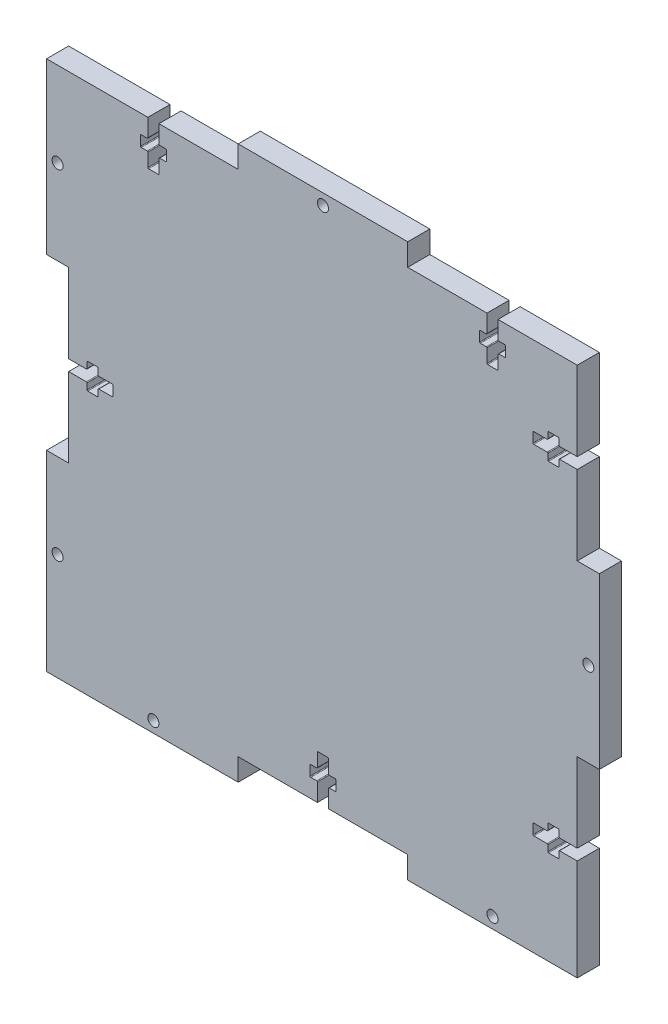
from build123d import *

# Parameters (mm, degrees)
BOX_SIDE_DEPTH       = 6
SKETCH2_R            = 1.5
SCREW_CUT_OUTS_DEPTH = 107.235587258


with BuildPart() as part:
    # Sketch1 → Box Side (new body)
    with BuildSketch(Plane.XY):
        Polygon((-69, 69), (-23, 69), (-23, 75), (23, 75), (23, 69), (69, 69), (69, 23), (75, 23), (75, -23), (69, -23), (69, -69), (69, -75), (23, -75), (23, -69), (-23, -69), (-23, -75), (-69, -75), (-75, -75), (-75, -69), (-75, -23), (-69, -23), (-69, 23), (-75, 23), (-75, 69), align=None)
    extrude(amount=BOX_SIDE_DEPTH)

    # Sketch2 → Screw Cut-outs (cut, through all)
    with BuildSketch(Plane.XY.offset(6)):
        with Locations((0, 72)):
            Circle(SKETCH2_R)
        with Locations((72, 0)):
            Circle(SKETCH2_R)
        with Locations((-46, -72)):
            Circle(SKETCH2_R)
        with Locations((46, -72)):
            Circle(SKETCH2_R)
        with Locations((-72, 46)):
            Circle(SKETCH2_R)
        with Locations((-72, -46)):
            Circle(SKETCH2_R)
        with BuildLine():
            Line((-44.5, 69), (-44.5, 64.2))
            ThreePointArc((-44.5, 64.2), (-44.441421356, 64.058578644), (-44.3, 64))
            Line((-44.3, 64), (-42.7, 64))
            ThreePointArc((-42.7, 64), (-42.558578644, 63.941421356), (-42.5, 63.8))
            Line((-42.5, 63.8), (-42.5, 61.2))
            ThreePointArc((-42.5, 61.2), (-42.558578644, 61.058578644), (-42.7, 61))
            Line((-42.7, 61), (-44.3, 61))
            ThreePointArc((-44.3, 61), (-44.441421356, 60.941421356), (-44.5, 60.8))
            Line((-44.5, 60.8), (-44.5, 57.2))
            ThreePointArc((-44.5, 57.2), (-44.558578644, 57.058578644), (-44.7, 57))
            Line((-44.7, 57), (-47.3, 57))
            ThreePointArc((-47.3, 57), (-47.441421356, 57.058578644), (-47.5, 57.2))
            Line((-47.5, 57.2), (-47.5, 60.8))
            ThreePointArc((-47.5, 60.8), (-47.558578644, 60.941421356), (-47.7, 61))
            Line((-47.7, 61), (-49.3, 61))
            ThreePointArc((-49.3, 61), (-49.441421356, 61.058578644), (-49.5, 61.2))
            Line((-49.5, 61.2), (-49.5, 63.8))
            ThreePointArc((-49.5, 63.8), (-49.441421356, 63.941421356), (-49.3, 64))
            Line((-49.3, 64), (-47.7, 64))
            ThreePointArc((-47.7, 64), (-47.558578644, 64.058578644), (-47.5, 64.2))
            Line((-47.5, 64.2), (-47.5, 69))
            Line((-47.5, 69), (-44.5, 69))
        make_face()
        with BuildLine():
            Line((47.5, 69), (47.5, 64.2))
            ThreePointArc((47.5, 64.2), (47.558578644, 64.058578644), (47.7, 64))
            Line((47.7, 64), (49.3, 64))
            ThreePointArc((49.3, 64), (49.441421356, 63.941421356), (49.5, 63.8))
            Line((49.5, 63.8), (49.5, 61.2))
            ThreePointArc((49.5, 61.2), (49.441421356, 61.058578644), (49.3, 61))
            Line((49.3, 61), (47.7, 61))
            ThreePointArc((47.7, 61), (47.558578644, 60.941421356), (47.5, 60.8))
            Line((47.5, 60.8), (47.5, 57.2))
            ThreePointArc((47.5, 57.2), (47.441421356, 57.058578644), (47.3, 57))
            Line((47.3, 57), (44.7, 57))
            ThreePointArc((44.7, 57), (44.558578644, 57.058578644), (44.5, 57.2))
            Line((44.5, 57.2), (44.5, 60.8))
            ThreePointArc((44.5, 60.8), (44.441421356, 60.941421356), (44.3, 61))
            Line((44.3, 61), (42.7, 61))
            ThreePointArc((42.7, 61), (42.558578644, 61.058578644), (42.5, 61.2))
            Line((42.5, 61.2), (42.5, 63.8))
            ThreePointArc((42.5, 63.8), (42.558578644, 63.941421356), (42.7, 64))
            Line((42.7, 64), (44.3, 64))
            ThreePointArc((44.3, 64), (44.441421356, 64.058578644), (44.5, 64.2))
            Line((44.5, 64.2), (44.5, 69))
            Line((44.5, 69), (47.5, 69))
        make_face()
        with BuildLine():
            Line((69, 44.5), (64.2, 44.5))
            ThreePointArc((64.2, 44.5), (64.058578644, 44.441421356), (64, 44.3))
            Line((64, 44.3), (64, 42.7))
            ThreePointArc((64, 42.7), (63.941421356, 42.558578644), (63.8, 42.5))
            Line((63.8, 42.5), (61.2, 42.5))
            ThreePointArc((61.2, 42.5), (61.058578644, 42.558578644), (61, 42.7))
            Line((61, 42.7), (61, 44.3))
            ThreePointArc((61, 44.3), (60.941421356, 44.441421356), (60.8, 44.5))
            Line((60.8, 44.5), (57.2, 44.5))
            ThreePointArc((57.2, 44.5), (57.058578644, 44.558578644), (57, 44.7))
            Line((57, 44.7), (57, 47.3))
            ThreePointArc((57, 47.3), (57.058578644, 47.441421356), (57.2, 47.5))
            Line((57.2, 47.5), (60.8, 47.5))
            ThreePointArc((60.8, 47.5), (60.941421356, 47.558578644), (61, 47.7))
            Line((61, 47.7), (61, 49.3))
            ThreePointArc((61, 49.3), (61.058578644, 49.441421356), (61.2, 49.5))
            Line((61.2, 49.5), (63.8, 49.5))
            ThreePointArc((63.8, 49.5), (63.941421356, 49.441421356), (64, 49.3))
            Line((64, 49.3), (64, 47.7))
            ThreePointArc((64, 47.7), (64.058578644, 47.558578644), (64.2, 47.5))
            Line((64.2, 47.5), (69, 47.5))
            Line((69, 47.5), (69, 44.5))
        make_face()
        with BuildLine():
            Line((69, -47.5), (64.2, -47.5))
            ThreePointArc((64.2, -47.5), (64.058578644, -47.558578644), (64, -47.7))
            Line((64, -47.7), (64, -49.3))
            ThreePointArc((64, -49.3), (63.941421356, -49.441421356), (63.8, -49.5))
            Line((63.8, -49.5), (61.2, -49.5))
            ThreePointArc((61.2, -49.5), (61.058578644, -49.441421356), (61, -49.3))
            Line((61, -49.3), (61, -47.7))
            ThreePointArc((61, -47.7), (60.941421356, -47.558578644), (60.8, -47.5))
            Line((60.8, -47.5), (57.2, -47.5))
            ThreePointArc((57.2, -47.5), (57.058578644, -47.441421356), (57, -47.3))
            Line((57, -47.3), (57, -44.7))
            ThreePointArc((57, -44.7), (57.058578644, -44.558578644), (57.2, -44.5))
            Line((57.2, -44.5), (60.8, -44.5))
            ThreePointArc((60.8, -44.5), (60.941421356, -44.441421356), (61, -44.3))
            Line((61, -44.3), (61, -42.7))
            ThreePointArc((61, -42.7), (61.058578644, -42.558578644), (61.2, -42.5))
            Line((61.2, -42.5), (63.8, -42.5))
            ThreePointArc((63.8, -42.5), (63.941421356, -42.558578644), (64, -42.7))
            Line((64, -42.7), (64, -44.3))
            ThreePointArc((64, -44.3), (64.058578644, -44.441421356), (64.2, -44.5))
            Line((64.2, -44.5), (69, -44.5))
            Line((69, -44.5), (69, -47.5))
        make_face()
        with BuildLine():
            Line((-1.5, -69), (1.5, -69))
            Line((1.5, -69), (1.5, -64.2))
            ThreePointArc((1.5, -64.2), (1.558578644, -64.058578644), (1.7, -64))
            Line((1.7, -64), (3.3, -64))
            ThreePointArc((3.3, -64), (3.441421356, -63.941421356), (3.5, -63.8))
            Line((3.5, -63.8), (3.5, -61.2))
            ThreePointArc((3.5, -61.2), (3.441421356, -61.058578644), (3.3, -61))
            Line((3.3, -61), (1.7, -61))
            ThreePointArc((1.7, -61), (1.558578644, -60.941421356), (1.5, -60.8))
            Line((1.5, -60.8), (1.5, -57.2))
            ThreePointArc((1.5, -57.2), (1.441421356, -57.058578644), (1.3, -57))
            Line((1.3, -57), (-1.3, -57))
            ThreePointArc((-1.3, -57), (-1.441421356, -57.058578644), (-1.5, -57.2))
            Line((-1.5, -57.2), (-1.5, -60.8))
            ThreePointArc((-1.5, -60.8), (-1.558578644, -60.941421356), (-1.7, -61))
            Line((-1.7, -61), (-3.3, -61))
            ThreePointArc((-3.3, -61), (-3.441421356, -61.058578644), (-3.5, -61.2))
            Line((-3.5, -61.2), (-3.5, -63.8))
            ThreePointArc((-3.5, -63.8), (-3.441421356, -63.941421356), (-3.3, -64))
            Line((-3.3, -64), (-1.7, -64))
            ThreePointArc((-1.7, -64), (-1.558578644, -64.058578644), (-1.5, -64.2))
            Line((-1.5, -64.2), (-1.5, -69))
        make_face()
        with BuildLine():
            Line((-69, -1.5), (-64.2, -1.5))
            ThreePointArc((-64.2, -1.5), (-64.058578644, -1.558578644), (-64, -1.7))
            Line((-64, -1.7), (-64, -3.3))
            ThreePointArc((-64, -3.3), (-63.941421356, -3.441421356), (-63.8, -3.5))
            Line((-63.8, -3.5), (-61.2, -3.5))
            ThreePointArc((-61.2, -3.5), (-61.058578644, -3.441421356), (-61, -3.3))
            Line((-61, -3.3), (-61, -1.7))
            ThreePointArc((-61, -1.7), (-60.941421356, -1.558578644), (-60.8, -1.5))
            Line((-60.8, -1.5), (-57.2, -1.5))
            ThreePointArc((-57.2, -1.5), (-57.058578644, -1.441421356), (-57, -1.3))
            Line((-57, -1.3), (-57, 1.3))
            ThreePointArc((-57, 1.3), (-57.058578644, 1.441421356), (-57.2, 1.5))
            Line((-57.2, 1.5), (-60.8, 1.5))
            ThreePointArc((-60.8, 1.5), (-60.941421356, 1.558578644), (-61, 1.7))
            Line((-61, 1.7), (-61, 3.3))
            ThreePointArc((-61, 3.3), (-61.058578644, 3.441421356), (-61.2, 3.5))
            Line((-61.2, 3.5), (-63.8, 3.5))
            ThreePointArc((-63.8, 3.5), (-63.941421356, 3.441421356), (-64, 3.3))
            Line((-64, 3.3), (-64, 1.7))
            ThreePointArc((-64, 1.7), (-64.058578644, 1.558578644), (-64.2, 1.5))
            Line((-64.2, 1.5), (-69, 1.5))
            Line((-69, 1.5), (-69, -1.5))
        make_face()
    extrude(amount=-SCREW_CUT_OUTS_DEPTH, mode=Mode.SUBTRACT)


solid = part.part
